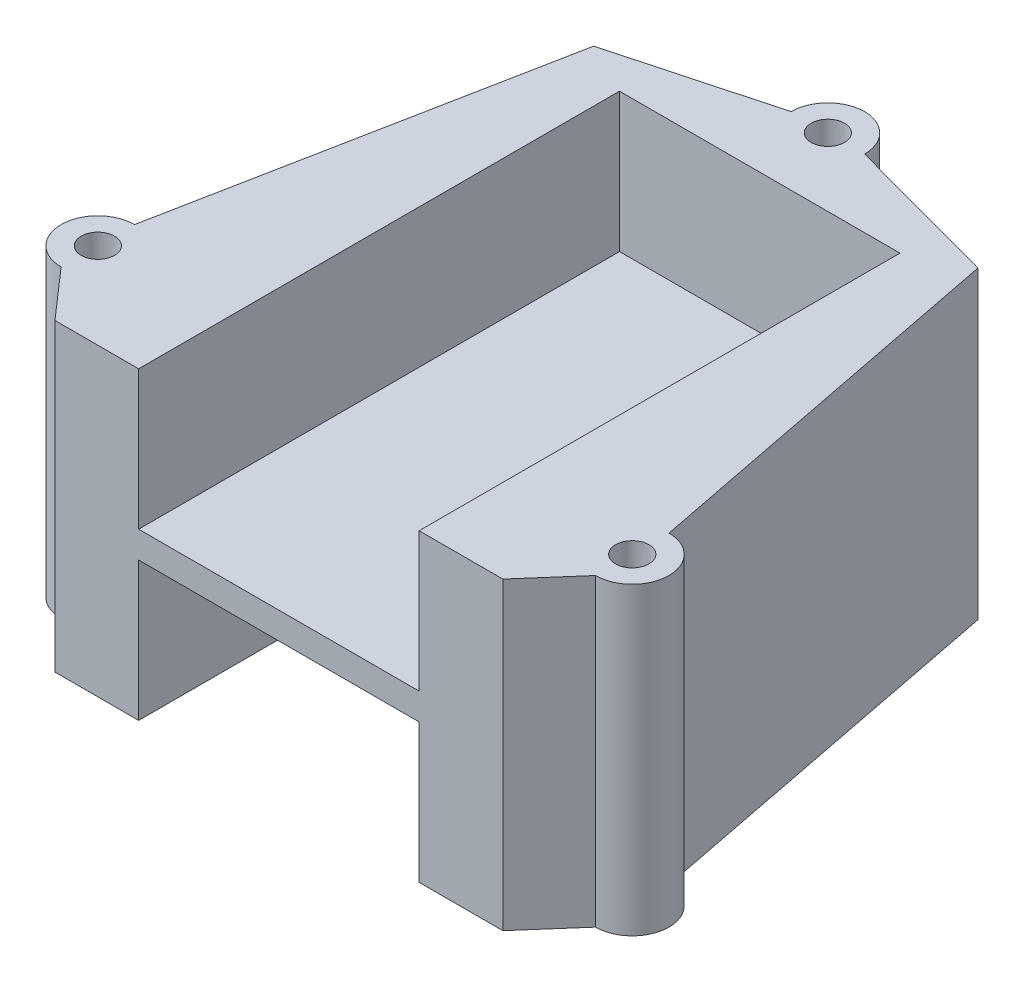
from build123d import *

# Parameters (mm, degrees)
SKETCH1_R           = 1.5875
BOSS_EXTRUDE1_DEPTH = 2.54
SKETCH2_R           = 1.5875
BOSS_EXTRUDE2_DEPTH = 28.956
SKETCH3_W           = 26.67
SKETCH3_H           = 17.78
CUT_EXTRUDE1_DEPTH  = 45.72


with BuildPart() as part:
    # Sketch1 → Boss-Extrude1 (new body)
    with BuildSketch(Plane(origin=(0, 0, 0), x_dir=(1, 0, 0), z_dir=(0, 1, 0))):
        with BuildLine():
            ThreePointArc((38.1, 0), (26.940768363, 26.940768363), (0, 38.1))
            ThreePointArc((0, 38.1), (-26.940768363, -26.940768363), (38.1, 0))
        make_face()
        with Locations((-25.406587271, -14.6685)):
            Circle(SKETCH1_R, mode=Mode.SUBTRACT)
        with Locations((25.406587271, -14.6685)):
            Circle(SKETCH1_R, mode=Mode.SUBTRACT)
        with BuildLine():
            ThreePointArc((1.5875, 29.337), (1.122532015, 28.214467985), (0, 27.7495))
            ThreePointArc((0, 27.7495), (-1.5875, 29.337), (0, 30.9245))
            ThreePointArc((0, 30.9245), (1.122532015, 30.459532015), (1.5875, 29.337))
        make_face(mode=Mode.SUBTRACT)
    extrude(amount=BOSS_EXTRUDE1_DEPTH)


with BuildPart() as body_2:
    # Sketch2 → Boss-Extrude2 (new body)
    with BuildSketch(Plane(origin=(0, 2.54, 0), x_dir=(1, 0, 0), z_dir=(0, 1, 0))):
        with BuildLine():
            Line((21.295139445, -22.86), (25.406587271, -18.161))
            ThreePointArc((25.406587271, -18.161), (28.899087271, -14.6685), (25.406587271, -11.176))
            Line((25.406587271, -11.176), (18.270749664, 25.342499299))
            Line((18.270749664, 25.342499299), (3.4925, 29.337))
            ThreePointArc((3.4925, 29.337), (0, 32.8295), (-3.4925, 29.337))
            Line((-3.4925, 29.337), (-18.270749664, 25.342499299))
            Line((-18.270749664, 25.342499299), (-25.406587271, -11.176))
            ThreePointArc((-25.406587271, -11.176), (-28.899087271, -14.6685), (-25.406587271, -18.161))
            Line((-25.406587271, -18.161), (-21.295139445, -22.86))
            Line((-21.295139445, -22.86), (21.295139445, -22.86))
        make_face()
        with Locations((25.406587271, -14.6685)):
            Circle(SKETCH2_R, mode=Mode.SUBTRACT)
        with Locations((-25.406587271, -14.6685)):
            Circle(SKETCH2_R, mode=Mode.SUBTRACT)
        with Locations((0, 29.337)):
            Circle(SKETCH2_R, mode=Mode.SUBTRACT)
    extrude(amount=BOSS_EXTRUDE2_DEPTH)

    # Sketch3 → Cut-Extrude1 (cut)
    with BuildSketch(Plane.XY.offset(22.86)):
        with Locations((0, 27.178)):
            Rectangle(SKETCH3_W, SKETCH3_H)
        with Locations((0, 6.858)):
            Rectangle(SKETCH3_W, SKETCH3_H)
    extrude(amount=-CUT_EXTRUDE1_DEPTH, mode=Mode.SUBTRACT)


solid = body_2.part
